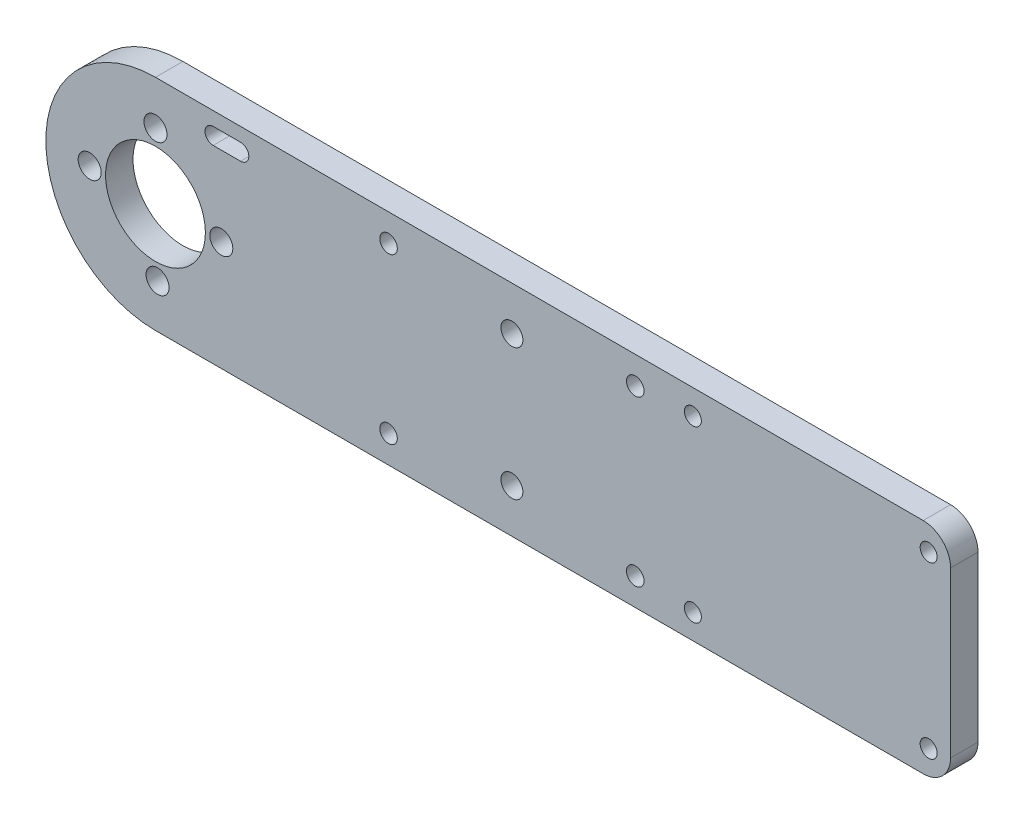
from build123d import *

# Parameters (mm, degrees)
SKETCH2_R           = 9.1
BOSS_EXTRUDE1_DEPTH = 2.5
FILLET1_R           = 5
SKETCH3_R           = 2.1
CUT_EXTRUDE1_DEPTH  = 147.458185159
SKETCH3_4_R         = 1.55
SKETCH3_4_R_2       = 1.6
SKETCH3_4_R_3       = 2
CUT_EXTRUDE2_DEPTH  = 10
SKETCH4_R           = 2.5
CUT_EXTRUDE3_DEPTH  = 2


with BuildPart() as part:
    # Sketch2 → Boss-Extrude1 (new, symmetric)
    with BuildSketch(Plane.XY):
        with BuildLine():
            Line((145, 20), (0, 20))
            ThreePointArc((0, 20), (-20, 0), (0, -20))
            Line((0, -20), (145, -20))
            Line((145, -20), (145, 20))
        make_face()
        Circle(SKETCH2_R, mode=Mode.SUBTRACT)
    extrude(amount=BOSS_EXTRUDE1_DEPTH, both=True)

    # Fillet1
    fillet1_edges = [part.edges().sort_by_distance(p)[0] for p in [
        (145, -20, 0),
        (145, 20, 0),
    ]]
    fillet(fillet1_edges, radius=FILLET1_R)

    # Sketch3 → Cut-Extrude1 (cut, through all)
    with BuildSketch(Plane(origin=(0, 0, -2.5), x_dir=(-1, 0, 0), z_dir=(0, 0, -1))):
        with Locations((-12, 0)):
            Circle(SKETCH3_R)
        with Locations((0, 12)):
            Circle(SKETCH3_R)
        with Locations((-0.376480941, -12)):
            Circle(SKETCH3_R)
        with Locations((12, 0)):
            Circle(SKETCH3_R)
    extrude(amount=-CUT_EXTRUDE1_DEPTH, mode=Mode.SUBTRACT)

    # Sketch3<4> → Cut-Extrude2 (cut)
    with BuildSketch(Plane(origin=(0, 0, -2.5), x_dir=(-1, 0, 0), z_dir=(0, 0, -1))):
        with Locations((-98, 15.5)):
            Circle(SKETCH3_4_R)
        with Locations((-87.5, 15)):
            Circle(SKETCH3_4_R_2)
        with Locations((-65, 12)):
            Circle(SKETCH3_4_R_3)
        with BuildLine():
            Line((-10.518524874, 17.5), (-15.518524874, 17.5))
            ThreePointArc((-15.518524874, 17.5), (-17.018524874, 16), (-15.518524874, 14.5))
            Line((-15.518524874, 14.5), (-10.518524874, 14.5))
            ThreePointArc((-10.518524874, 14.5), (-9.018524874, 16), (-10.518524874, 17.5))
        make_face()
        with Locations((-98, -15.5)):
            Circle(SKETCH3_4_R)
        with Locations((-141, -15.5)):
            Circle(SKETCH3_4_R)
        with Locations((-141, 15.5)):
            Circle(SKETCH3_4_R)
        with Locations((-87.5, -15)):
            Circle(SKETCH3_4_R_2)
        with Locations((-42.5, -15)):
            Circle(SKETCH3_4_R_2)
        with Locations((-42.5, 15)):
            Circle(SKETCH3_4_R_2)
        with Locations((-65, -12)):
            Circle(SKETCH3_4_R_3)
    extrude(amount=-CUT_EXTRUDE2_DEPTH, mode=Mode.SUBTRACT)

    # Sketch4 → Cut-Extrude3 (cut)
    with BuildSketch(Plane(origin=(0, 0, -2.5), x_dir=(-1, 0, 0), z_dir=(0, 0, -1))):
        with Locations((-42.5, 15)):
            Circle(SKETCH4_R)
        with Locations((-42.5, -15)):
            Circle(SKETCH4_R)
    extrude(amount=-CUT_EXTRUDE3_DEPTH, mode=Mode.SUBTRACT)


solid = part.part
